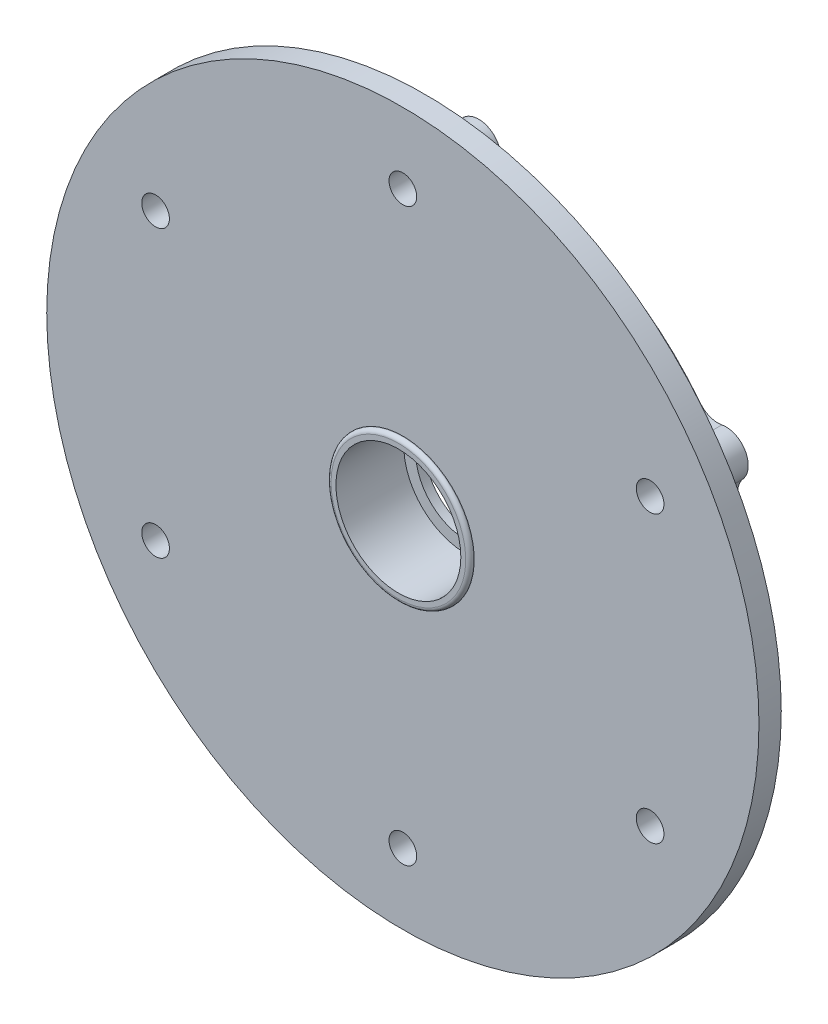
from build123d import *

# Parameters (mm, degrees)
BOSS_EXTRUDE2_DEPTH      = 2
SKETCH9_R                = 3
CUT_EXTRUDE10_DEPTH      = 11
THREAD6_PITCH            = 1
CIRPATTERN1_COUNT        = 2
SKETCH4_R                = 5
BOSS_EXTRUDE3_DEPTH      = 17
SKETCH11_R               = 3.1
CUT_EXTRUDE4_DEPTH       = 95.968415887
FILLET2_R                = 5
CIRPATTERN2_COUNT        = 6
FILLET2_OF_CIRPATTERN2_R = 5
BOSS_EXTRUDE4_START      = -5
BOSS_EXTRUDE4_OUTLINE_R  = 79.82770553
BOSS_EXTRUDE4_DEPTH      = 5
SKETCH12_W               = 16
SKETCH12_H               = 1
FILLET3_R                = 0.9
CUT_EXTRUDE13_START      = -5
SKETCH20_R               = 14
CUT_EXTRUDE13_DEPTH      = 5


# Read off the part's stored shape, not the designer's step: Boss-Extrude4
with BuildPart() as part:
    # Sketch2 → Revolve1 (revolve)
    with BuildSketch(Plane(origin=(0, 0, 0), x_dir=(0, 0, -1), z_dir=(1, 0, 0)), mode=Mode.PRIVATE) as revolve1_sk:
        with BuildLine():
            Line((0.160377358, 63), (-16.839622642, 63))
            Line((-16.839622642, 63), (-16.839622642, 14))
            Line((-16.839622642, 14), (-2.639622642, 14))
            Line((-2.639622642, 14), (-2.639622642, 11.314773991))
            Line((-2.639622642, 11.314773991), (-0.639622642, 11.314773991))
            Line((-0.639622642, 11.314773991), (-0.639622642, 16.500000001))
            ThreePointArc((-0.639622642, 16.500000001), (-0.93251586, 17.207106782), (-1.639622642, 17.500000001))
            Line((-1.639622642, 17.500000001), (-2.439622642, 17.5))
            Line((-2.439622642, 17.5), (-2.439622642, 16.8))
            Line((-2.439622642, 16.8), (-3.839622642, 16.8))
            Line((-3.839622642, 16.8), (-3.839622642, 17.5))
            Line((-3.839622642, 17.5), (-13.839622642, 17.5))
            Line((-13.839622642, 17.5), (-13.839622642, 57))
            ThreePointArc((-13.839622642, 57), (-13.546729423, 57.707106781), (-12.839622642, 58))
            Line((-12.839622642, 58), (0.160377358, 58))
            Line((0.160377358, 58), (0.160377358, 63))
        make_face()
    revolve(revolve1_sk.sketch.rotate(Axis((0, 0, 66.5), (0, 0, -1)), 90), axis=Axis((0, 0, 66.5), (0, 0, -1)))

    # Sketch8 → Boss-Extrude2 (add, symmetric)
    with BuildSketch(Plane(origin=(31.5, -54.559600438, 0), x_dir=(0, 0, 1), z_dir=(0.500000000000001, -0.866025403784438, 0))):
        with BuildLine():
            Line((3.839622642, -4), (9.839622642, -4))
            ThreePointArc((9.839622642, -4), (10.546729423, -3.707106781), (10.839622642, -3))
            Line((10.839622642, -3), (10.839622642, 3))
            ThreePointArc((10.839622642, 3), (10.546729423, 3.707106781), (9.839622642, 4))
            Line((9.839622642, 4), (3.839622642, 4))
            ThreePointArc((3.839622642, 4), (3.13251586, 3.707106781), (2.839622642, 3))
            Line((2.839622642, 3), (2.839622642, -3))
            ThreePointArc((2.839622642, -3), (3.13251586, -3.707106781), (3.839622642, -4))
        make_face()
    boss_extrude2 = extrude(amount=BOSS_EXTRUDE2_DEPTH, both=True)

    # Sketch9 → Cut-Extrude10 (cut)
    with BuildSketch(Plane(origin=(32.5, -56.291651246, 0), x_dir=(0, 0, 1), z_dir=(0.500000000000001, -0.866025403784438, 0))):
        with Locations(Location((6.839622642, 0, 0), (0, 0, 270))):
            Circle(SKETCH9_R)
    cut_extrude10 = extrude(amount=-CUT_EXTRUDE10_DEPTH, mode=Mode.SUBTRACT)

    # Thread6: the profile of Thread Profile9 profile screwed along a right-hand helix of 10 turns, 8 arcs to a turn; built about Z, then put on its axis
    thread6_z = Axis((0, 0, 0), (0, 0, 1))
    thread6_corners = [(2.9997, 0, -0.000173205), (3.541265875, 0, 0.312499999), (3.541265875, 0, 0.437499999), (2.9997, 0, 0.750173203)]
    with BuildLine(mode=Mode.PRIVATE) as thread6_profile:
        Line(thread6_corners[0], thread6_corners[1])
        Line(thread6_corners[1], thread6_corners[2])
        Line(thread6_corners[2], thread6_corners[3])
        Line(thread6_corners[3], thread6_corners[0])
    thread6_cap = Face(thread6_profile.wire())
    thread6_turn_angles = [0, 22.5, 45, 67.5, 90, 112.5, 135, 157.5, 180, 202.5, 225, 247.5, 270, 292.5, 315, 337.5, 360]
    thread6_turn_weights = [1, 0.9238795325112867, 1, 0.9238795325112867, 1, 0.9238795325112867, 1, 0.9238795325112867, 1, 0.9238795325112867, 1, 0.9238795325112867, 1, 0.9238795325112867, 1, 0.9238795325112867, 1]
    thread6_turn_rails = [Edge.make_bspline([Vector(p[0], p[1], 0).rotate(thread6_z, thread6_turn_angles[k]) / thread6_turn_weights[k] + Vector(0, 0, p[2] + THREAD6_PITCH * thread6_turn_angles[k] / 360) for k in range(17)], [0, 0, 0, 1, 1, 2, 2, 3, 3, 4, 4, 5, 5, 6, 6, 7, 7, 8, 8, 8], 2, thread6_turn_weights) for p in thread6_corners]
    thread6_turn_sides = [Face.make_surface_from_curves(thread6_turn_rails[p[0]], thread6_turn_rails[p[1]]) for p in [(0, 1), (1, 2), (2, 3), (3, 0)]]
    thread6 = Plane(origin=(32.5, -56.291651246, 6.839622642), x_dir=(0.866025404, 0.5, 0), z_dir=(-0.5, 0.866025404, 0)) * Solid(Shell([*[p.moved(Location((0, 0, THREAD6_PITCH * i))) for i in range(10) for p in thread6_turn_sides], thread6_cap, thread6_cap.rotate(thread6_z, 3600).moved(Location((0, 0, THREAD6_PITCH * 3600 / 360)))]))
    add(thread6, mode=Mode.SUBTRACT)

    # CirPattern1: Boss-Extrude2, Cut-Extrude10, Thread6 ×2 about axis
    cirpattern1_axis = Axis((0, 0, 0), (0, 0, 1))
    add([boss_extrude2.rotate(cirpattern1_axis, i * 360 / CIRPATTERN1_COUNT) for i in range(1, CIRPATTERN1_COUNT)])
    add([cut_extrude10.rotate(cirpattern1_axis, i * 360 / CIRPATTERN1_COUNT) for i in range(1, CIRPATTERN1_COUNT)], mode=Mode.SUBTRACT)
    add([thread6.rotate(cirpattern1_axis, i * 360 / CIRPATTERN1_COUNT) for i in range(1, CIRPATTERN1_COUNT)], mode=Mode.SUBTRACT)

    # Sketch4 → Boss-Extrude3 (add, through all)
    with BuildSketch(Plane(origin=(0, 0, -0.160377358), x_dir=(-1, 0, 0), z_dir=(0, 0, -1))):
        with Locations((0, 64)):
            Circle(SKETCH4_R)
    boss_extrude3 = extrude(amount=-BOSS_EXTRUDE3_DEPTH)

    # Sketch11 → Cut-Extrude4 (cut, through all)
    with BuildSketch(Plane(origin=(0, 0, -0.160377358), x_dir=(-1, 0, 0), z_dir=(0, 0, -1))):
        with Locations((0, 64)):
            Circle(SKETCH11_R)
    cut_extrude4 = extrude(amount=-CUT_EXTRUDE4_DEPTH, mode=Mode.SUBTRACT)

    # Fillet2
    fillet2_edges = [part.edges().sort_by_distance(p)[0] for p in [
        (-4.856937693, 62.8125, 8.339622642),
        (4.856937693, 62.8125, 8.339622642),
    ]]
    fillet(fillet2_edges, radius=FILLET2_R)

    # CirPattern2: Boss-Extrude3, Cut-Extrude4 ×6 about axis
    cirpattern2_axis = Axis((0, 0, 0), (0, 0, 1))
    add([boss_extrude3.rotate(cirpattern2_axis, i * 360 / CIRPATTERN2_COUNT) for i in range(1, CIRPATTERN2_COUNT)])
    add([cut_extrude4.rotate(cirpattern2_axis, i * 360 / CIRPATTERN2_COUNT) for i in range(1, CIRPATTERN2_COUNT)], mode=Mode.SUBTRACT)

    # Fillet2 of CirPattern2
    fillet2_of_cirpattern2_edges = [part.edges().sort_by_distance(p)[0] for p in [
        (-56.825689522, 27.200018574, 8.339622642),
        (-51.968751829, 35.612481426, 8.339622642),
        (-51.968751829, -35.612481426, 8.339622642),
        (-56.825689522, -27.200018574, 8.339622642),
        (4.856937693, -62.8125, 8.339622642),
        (-4.856937693, -62.8125, 8.339622642),
        (56.825689522, -27.200018574, 8.339622642),
        (51.968751829, -35.612481426, 8.339622642),
        (51.968751829, 35.612481426, 8.339622642),
        (56.825689522, 27.200018574, 8.339622642),
    ]]
    fillet(fillet2_of_cirpattern2_edges, radius=FILLET2_OF_CIRPATTERN2_R)

    # Boss-Extrude4 outline → Boss-Extrude4 (add)
    with BuildSketch(Plane.XY.offset(16.839622642).offset(BOSS_EXTRUDE4_START)):
        Circle(BOSS_EXTRUDE4_OUTLINE_R)
        with BuildLine():
            ThreePointArc((8.731430423, 62.392003676), (31.5, 54.559600438), (49.667344965, 38.757642396))
            ThreePointArc((49.667344965, 38.757642396), (51.834966893, 37.159022257), (54.517411791, 36.91682288))
            ThreePointArc((54.517411791, 36.91682288), (59.755752861, 34.5), (59.229612337, 28.75505212))
            ThreePointArc((59.229612337, 28.75505212), (58.098140701, 26.310887005), (58.398775388, 23.63436128))
            ThreePointArc((58.398775388, 23.63436128), (63, 0), (58.398775388, -23.63436128))
            ThreePointArc((58.398775388, -23.63436128), (58.098140701, -26.310887005), (59.229612337, -28.75505212))
            ThreePointArc((59.229612337, -28.75505212), (59.755752861, -34.5), (54.517411791, -36.91682288))
            ThreePointArc((54.517411791, -36.91682288), (51.834966893, -37.159022257), (49.667344965, -38.757642396))
            ThreePointArc((49.667344965, -38.757642396), (31.5, -54.559600438), (8.731430423, -62.392003676))
            ThreePointArc((8.731430423, -62.392003676), (6.263173808, -63.469909262), (4.712200546, -65.671875))
            ThreePointArc((4.712200546, -65.671875), (0, -69), (-4.712200546, -65.671875))
            ThreePointArc((-4.712200546, -65.671875), (-6.263173808, -63.469909262), (-8.731430423, -62.392003676))
            ThreePointArc((-8.731430423, -62.392003676), (-31.5, -54.559600438), (-49.667344965, -38.757642396))
            ThreePointArc((-49.667344965, -38.757642396), (-51.834966893, -37.159022257), (-54.517411791, -36.91682288))
            ThreePointArc((-54.517411791, -36.91682288), (-59.755752861, -34.5), (-59.229612337, -28.75505212))
            ThreePointArc((-59.229612337, -28.75505212), (-58.098140701, -26.310887005), (-58.398775388, -23.63436128))
            ThreePointArc((-58.398775388, -23.63436128), (-63, 0), (-58.398775388, 23.63436128))
            ThreePointArc((-58.398775388, 23.63436128), (-58.098140701, 26.310887005), (-59.229612337, 28.75505212))
            ThreePointArc((-59.229612337, 28.75505212), (-59.755752861, 34.5), (-54.517411791, 36.91682288))
            ThreePointArc((-54.517411791, 36.91682288), (-51.834966893, 37.159022257), (-49.667344965, 38.757642396))
            ThreePointArc((-49.667344965, 38.757642396), (-31.5, 54.559600438), (-8.731430423, 62.392003676))
            ThreePointArc((-8.731430423, 62.392003676), (-6.263173808, 63.469909262), (-4.712200546, 65.671875))
            ThreePointArc((-4.712200546, 65.671875), (0, 69), (4.712200546, 65.671875))
            ThreePointArc((4.712200546, 65.671875), (6.263173808, 63.469909262), (8.731430423, 62.392003676))
        make_face(mode=Mode.SUBTRACT)
    extrude(amount=BOSS_EXTRUDE4_DEPTH)

    # Sketch12 → Revolve3 (revolve)
    with BuildSketch(Plane(origin=(0, 0, 0), x_dir=(1, 0, 0), z_dir=(0, 1, 0)), mode=Mode.PRIVATE) as revolve3_sk:
        with Locations((8, -17.339622642)):
            Rectangle(SKETCH12_W, SKETCH12_H)
    revolve(revolve3_sk.sketch.rotate(Axis((0, 0, 16.839622642), (0, 0, 1)), 180), axis=Axis((0, 0, 16.839622642), (0, 0, 1)))

    # Fillet3
    fillet3_edges = [part.edges().sort_by_distance(p)[0] for p in [
        (16, 0, 17.839622642),
    ]]
    fillet(fillet3_edges, radius=FILLET3_R)

    # Sketch20 → Cut-Extrude13 (cut)
    with BuildSketch(Plane.XY.offset(17.839622642).offset(CUT_EXTRUDE13_START)):
        Circle(SKETCH20_R)
    extrude(amount=CUT_EXTRUDE13_DEPTH, mode=Mode.SUBTRACT)


solid = part.part
